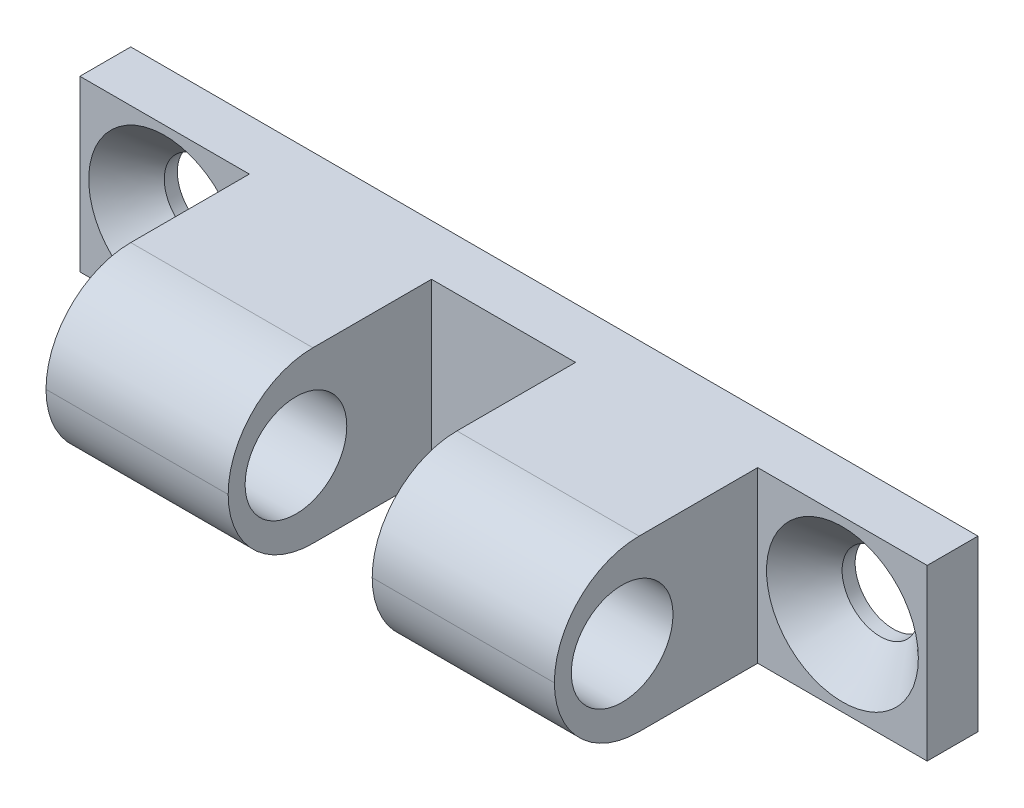
from build123d import *

# Parameters (mm, degrees)
EXTRUDE_1_DEPTH             = 5
HOLE_WIZARD_M4_1_AT_2_COUNT = 2
HOLE_WIZARD_M4_1_AT_2_PITCH = 40
SKETCH_3_R                  = 3
CUT_EXTRUDE_2_DEPTH         = 44.011626335
FILLET_1_R                  = 5


with BuildPart() as part:
    # 草图1 → 拉伸1 (new, symmetric)
    with BuildSketch(Plane(origin=(0, 0, 0), x_dir=(1, 0, 0), z_dir=(0, 1, 0))):
        Polygon((4.25, -3), (4.25, -15), (15, -15), (15, -3), (25, -3), (25, 0), (-25, 0), (-25, -3), (-15, -3), (-15, -15), (-4.25, -15), (-4.25, -3), align=None)
    extrude(amount=EXTRUDE_1_DEPTH, both=True)

    # 草图2 → M4 六角凹锥坑螺钉的锥形沉头孔1 (revolve, cut)
    with BuildSketch(Plane(origin=(-20, 0, 3), x_dir=(0, -1, 0), z_dir=(1, 0, 0))):
        Polygon((0, 0), (0, 3), (2.25, 3), (2.25, 2.23), (4.48, 0), align=None)
    hole_wizard_m4_1 = revolve(axis=Axis((-20, 0, 9.35), (0, 0, -1)), mode=Mode.SUBTRACT)

    # M4 六角凹锥坑螺钉的锥形沉头孔1 at 2: M4 六角凹锥坑螺钉的锥形沉头孔1 ×2
    with Locations(*[(i * HOLE_WIZARD_M4_1_AT_2_PITCH, 0, 0) for i in range(1, HOLE_WIZARD_M4_1_AT_2_COUNT)]):
        add(hole_wizard_m4_1, mode=Mode.SUBTRACT)

    # 草图3 → 拉伸2 (cut, through all)
    with BuildSketch(Plane(origin=(15, 0, 0), x_dir=(0, 0, -1), z_dir=(1, 0, 0))):
        with Locations((-11, 0)):
            Circle(SKETCH_3_R)
    extrude(amount=-CUT_EXTRUDE_2_DEPTH, mode=Mode.SUBTRACT)

    # 圆角1
    fillet_1_edges = [part.edges().sort_by_distance(p)[0] for p in [
        (-9.625, -5, 15),
        (9.625, -5, 15),
        (9.625, 5, 15),
        (-9.625, 5, 15),
    ]]
    fillet(fillet_1_edges, radius=FILLET_1_R - 0.0001)  # a hair under: the kernel refuses the full size


solid = part.part
